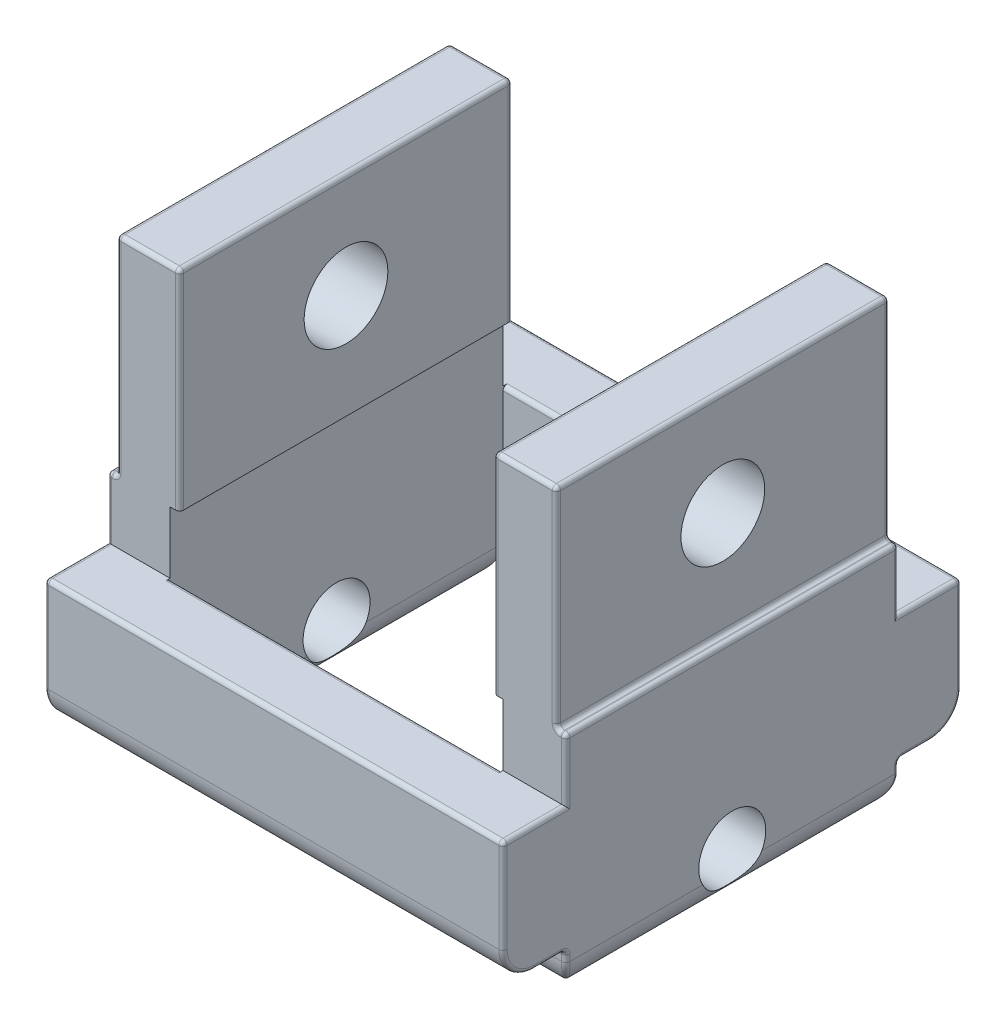
from build123d import *

# Parameters (mm, degrees)
BOSS_EXTRUDE1_DEPTH     = 7.9502
BOSS_EXTRUDE1_2_DEPTH   = 7.9502
BOSS_EXTRUDE2_START     = -10.9502
SKETCH3_W               = 3
SKETCH3_H               = 6
BOSS_EXTRUDE2_DEPTH     = 21.9004
CUT_EXTRUDE1_DEPTH      = 29.626852431
CUT_EXTRUDE1_DEPTH_BACK = 29.626852431
SKETCH4_R               = 2
SKETCH5_R               = 1.6
CUT_EXTRUDE2_DEPTH      = 29.965723195
FILLET1_R               = 1.5
FILLET2_R               = 0.2


with BuildPart() as part:
    # Sketch2 → Boss-Extrude1 (new, symmetric)
    with BuildSketch(Plane.XY):
        Polygon((10.5, 5.4751), (10.9502, 5.4751), (10.9502, -5.4751), (7.9502, -5.4751), (7.9502, 5.4751), (7.5, 5.4751), (7.5, 15.4751), (10.5, 15.4751), align=None)
    extrude(amount=BOSS_EXTRUDE1_DEPTH, both=True)



with BuildPart() as body_2:
    # Sketch2 → Boss-Extrude1 2 (new, symmetric)
    with BuildSketch(Plane.XY):
        Polygon((-10.9502, -5.4751), (-7.9502, -5.4751), (-7.9502, 5.4751), (-7.5, 5.4751), (-7.5, 15.4751), (-10.5, 15.4751), (-10.5, 5.4751), (-10.9502, 5.4751), align=None)
    extrude(amount=BOSS_EXTRUDE1_2_DEPTH, both=True)


with BuildPart() as part_1:
    add(part.part)

    add(body_2.part)  # Boss-Extrude2 merges body 2
    # Sketch3 → Boss-Extrude2 (add)
    with BuildSketch(Plane(origin=(0, 0, 0), x_dir=(0, 0, -1), z_dir=(1, 0, 0)).offset(BOSS_EXTRUDE2_START)):
        with Locations((-9.4502, -0.4751)):
            Rectangle(SKETCH3_W, SKETCH3_H)
        with Locations((9.4502, -0.4751)):
            Rectangle(SKETCH3_W, SKETCH3_H)
    extrude(amount=BOSS_EXTRUDE2_DEPTH)

    # Sketch4 → Cut-Extrude1 (cut, two sides: drawn at the far end of the back side and taken through both)
    with BuildSketch(Plane(origin=(10.5, 0, 0), x_dir=(0, 0, -1), z_dir=(1, 0, 0)).offset(-CUT_EXTRUDE1_DEPTH_BACK)):
        with Locations((0, 10.4751)):
            Circle(SKETCH4_R)
    extrude(amount=CUT_EXTRUDE1_DEPTH + CUT_EXTRUDE1_DEPTH_BACK, mode=Mode.SUBTRACT)

    # Sketch5 → Cut-Extrude2 (cut, through all)
    with BuildSketch(Plane(origin=(10.9502, 0, 0), x_dir=(0, 0, -1), z_dir=(1, 0, 0))):
        with Locations((0, -3.2251)):
            Circle(SKETCH5_R)
    extrude(amount=-CUT_EXTRUDE2_DEPTH, mode=Mode.SUBTRACT)

    # Fillet1
    # the kernel refuses this fillet: 1.5 mm, written as the material it takes off along each edge
    with BuildSketch(Plane(origin=(-7.9502, -5.4751, -11.7002), x_dir=(0, 1, 0), z_dir=(0, 0, 1)), Plane(origin=(-10.9502, -5.4751, 11.7002), x_dir=(0, 1, 0), z_dir=(0, 0, -1)), Plane(origin=(7.9502, -5.4751, 11.7002), x_dir=(0, 1, 0), z_dir=(0, 0, -1))) as fillet1_piece_1:
        with BuildLine():
            CenterArc((FILLET1_R, FILLET1_R), FILLET1_R, 180, 90)
            Line((0, FILLET1_R), (0, 0))
            Line((0, 0), (FILLET1_R, 0))
        make_face()
    extrude(amount=23.4004, mode=Mode.SUBTRACT)
    with BuildSketch(Plane(origin=(-14.7002, -5.4751, 7.9502), x_dir=(0, 1, 0), z_dir=(1, 0, 0)), Plane(origin=(14.7002, -5.4751, 7.9502), x_dir=(0, 0, -1), z_dir=(-1, 0, 0)), Plane(origin=(14.7002, -5.4751, -7.9502), x_dir=(0, 1, 0), z_dir=(-1, 0, 0))) as fillet1_piece_2:
        with BuildLine():
            CenterArc((FILLET1_R, -FILLET1_R), FILLET1_R, 90, 90)
            Line((0, -FILLET1_R), (0, 0))
            Line((0, 0), (FILLET1_R, 0))
        make_face()
    extrude(amount=10.5, mode=Mode.SUBTRACT)
    with BuildSketch(Plane(origin=(-14.7002, -3.4751, 10.9502), x_dir=(0, 1, 0), z_dir=(1, 0, 0))) as fillet1_piece_3:
        with BuildLine():
            CenterArc((FILLET1_R, -FILLET1_R), FILLET1_R, 90, 90)
            Line((0, -FILLET1_R), (0, 0))
            Line((0, 0), (FILLET1_R, 0))
        make_face()
    extrude(amount=29.4004, mode=Mode.SUBTRACT)
    with BuildSketch(Plane(origin=(-7.9502, -3.4751, 7.9502), x_dir=(0, 0, 1), z_dir=(1, 0, 0))) as fillet1_piece_4:
        with BuildLine():
            CenterArc((FILLET1_R, -FILLET1_R), FILLET1_R, 90, 90)
            Line((0, -FILLET1_R), (0, 0))
            Line((0, 0), (FILLET1_R, 0))
        make_face()
    extrude(amount=15.9004, mode=Mode.SUBTRACT)
    with BuildSketch(Plane(origin=(10.9502, -5.4751, 11.7002), x_dir=(0, 1, 0), z_dir=(0, 0, -1))) as fillet1_piece_5:
        with BuildLine():
            CenterArc((FILLET1_R, -FILLET1_R), FILLET1_R, 90, 90)
            Line((0, -FILLET1_R), (0, 0))
            Line((0, 0), (FILLET1_R, 0))
        make_face()
    extrude(amount=23.4004, mode=Mode.SUBTRACT)
    with BuildSketch(Plane(origin=(-7.9502, -3.4751, -7.9502), x_dir=(0, 0, -1), z_dir=(1, 0, 0))) as fillet1_piece_6:
        with BuildLine():
            CenterArc((FILLET1_R, FILLET1_R), FILLET1_R, 180, 90)
            Line((0, FILLET1_R), (0, 0))
            Line((0, 0), (FILLET1_R, 0))
        make_face()
    extrude(amount=15.9004, mode=Mode.SUBTRACT)
    with BuildSketch(Plane(origin=(-14.7002, -3.4751, -10.9502), x_dir=(0, 1, 0), z_dir=(1, 0, 0))) as fillet1_piece_7:
        with BuildLine():
            CenterArc((FILLET1_R, FILLET1_R), FILLET1_R, 180, 90)
            Line((0, FILLET1_R), (0, 0))
            Line((0, 0), (FILLET1_R, 0))
        make_face()
    extrude(amount=29.4004, mode=Mode.SUBTRACT)
    with BuildSketch(Plane(origin=(-14.7002, -5.4751, -7.9502), x_dir=(0, 1, 0), z_dir=(1, 0, 0))) as fillet1_piece_8:
        with BuildLine():
            CenterArc((FILLET1_R, FILLET1_R), FILLET1_R, 180, 90)
            Line((0, FILLET1_R), (0, 0))
            Line((0, 0), (FILLET1_R, 0))
        make_face()
    extrude(amount=10.5, mode=Mode.SUBTRACT)

    # Fillet2
    fillet2_edges = [part_1.edges().sort_by_distance(p)[0] for p in [
        (-10.5, 10.4751, -7.9502),
        (-9, 15.4751, -7.9502),
        (-7.5, 10.4751, -7.9502),
        (-10.9502, -3.035760172, 10.510860172),
        (-9, 15.4751, 7.9502),
        (10.9502, -3.7251, 7.9502),
        (10.9502, -3.7251, -7.9502),
        (10.9502, -3.035760172, 10.510860172),
        (10.9502, -3.035760172, -10.510860172),
        (-10.9502, 5.4751, 0),
        (-10.5, 5.4751, 0),
        (-10.5, 15.4751, 0),
        (-7.5, 15.4751, 0),
        (-10.5, 10.4751, 7.9502),
        (-10.419273361, -5.120044025, 7.419273361),
        (10.419273361, -5.120044025, 7.419273361),
        (10.419273361, -5.120044025, -7.419273361),
        (-10.7251, 5.4751, 7.9502),
        (-10.9502, 4, 7.9502),
        (-10.9502, -3.7251, 7.9502),
        (-9.4502, -3.4751, 7.9502),
        (9.4502, -3.4751, 7.9502),
        (10.9502, -3.4751, 8.7002),
        (0, 2.5249, 10.9502),
        (-10.9502, 0.2749, 10.9502),
        (-10.9502, 2.5249, 9.4502),
        (10.9502, 2.5249, 9.4502),
        (10.9502, 0.2749, 10.9502),
        (-10.9502, -3.4751, 8.7002),
        (0, 2.5249, 7.9502),
        (10.5, 10.4751, -7.9502),
        (10.5, 5.4751, 0),
        (9, 15.4751, -7.9502),
        (10.5, 15.4751, 0),
        (7.5, 10.4751, -7.9502),
        (7.5, 15.4751, 0),
        (10.7251, 5.4751, -7.9502),
        (10.9502, 5.4751, 0),
        (10.9502, 4, 7.9502),
        (10.7251, 5.4751, 7.9502),
        (10.5, 10.4751, 7.9502),
        (9, 15.4751, 7.9502),
        (7.5, 10.4751, 7.9502),
        (10.9502, 4, -7.9502),
        (0, 2.5249, -7.9502),
        (9.4502, -3.4751, -7.9502),
        (-9.4502, -3.4751, -7.9502),
        (10.9502, 0.2749, -10.9502),
        (10.9502, 2.5249, -9.4502),
        (0, 2.5249, -10.9502),
        (10.9502, -3.4751, -8.7002),
        (-10.9502, 2.5249, -9.4502),
        (-7.5, 10.4751, 7.9502),
        (-10.9502, 4, -7.9502),
        (-10.7251, 5.4751, -7.9502),
    ]]
    fillet(fillet2_edges, radius=FILLET2_R)


solid = part_1.part
